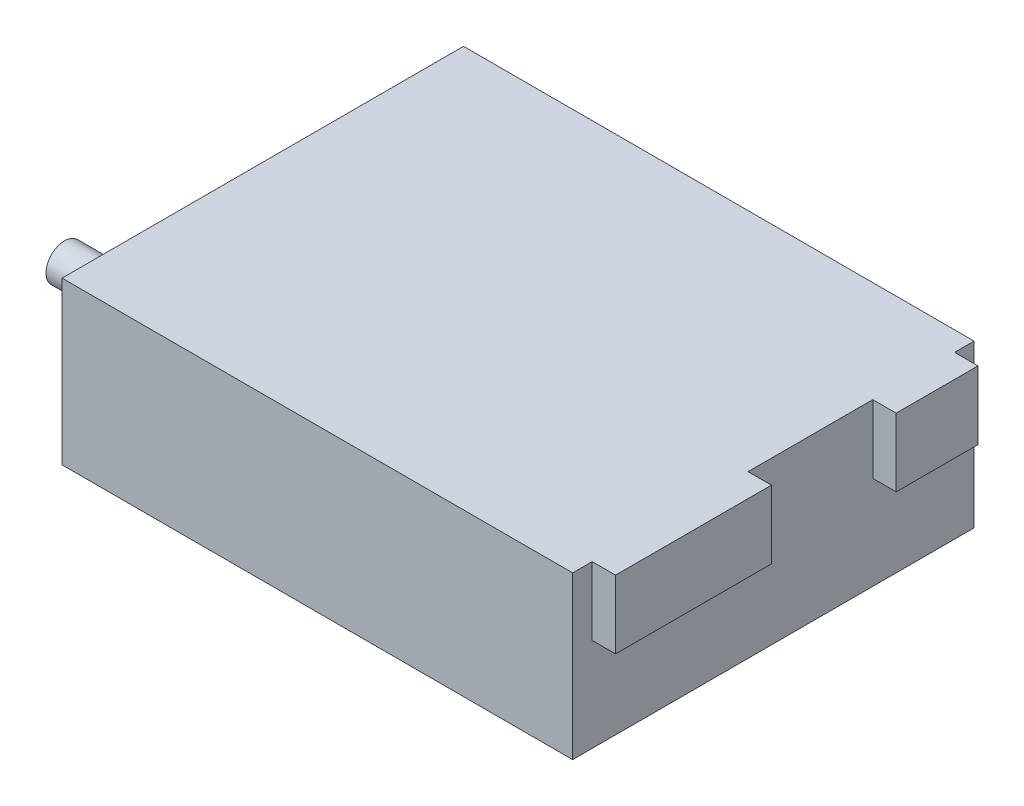
from build123d import *

# Parameters (mm, degrees)
SKETCH1_W           = 26.2
SKETCH1_H           = 20.6
BOSS_EXTRUDE1_DEPTH = 8.3
SKETCH2_W           = 8
SKETCH2_H           = 3.5
SKETCH2_W_2         = 4.2
BOSS_EXTRUDE2_DEPTH = 1.2
SKETCH3_R           = 0.95
BOSS_EXTRUDE3_DEPTH = 5


with BuildPart() as part:
    # Sketch1 → Boss-Extrude1 (new body)
    with BuildSketch(Plane(origin=(0, 0, 0), x_dir=(1, 0, 0), z_dir=(0, 1, 0))):
        Rectangle(SKETCH1_W, SKETCH1_H)
    extrude(amount=BOSS_EXTRUDE1_DEPTH)

    # Sketch2 → Boss-Extrude2 (add)
    with BuildSketch(Plane(origin=(13.1, 0, 0), x_dir=(0, 0, -1), z_dir=(1, 0, 0))):
        with Locations((-5.3, 6.55)):
            Rectangle(SKETCH2_W, SKETCH2_H)
        with Locations((7.2, 6.55)):
            Rectangle(SKETCH2_W_2, SKETCH2_H)
    extrude(amount=BOSS_EXTRUDE2_DEPTH)

    # Sketch3 → Boss-Extrude3 (add)
    with BuildSketch(Plane.ZY.offset(13.1)):
        with Locations((5.174837269, 3.945319614)):
            Circle(SKETCH3_R)
    extrude(amount=BOSS_EXTRUDE3_DEPTH)


solid = part.part
